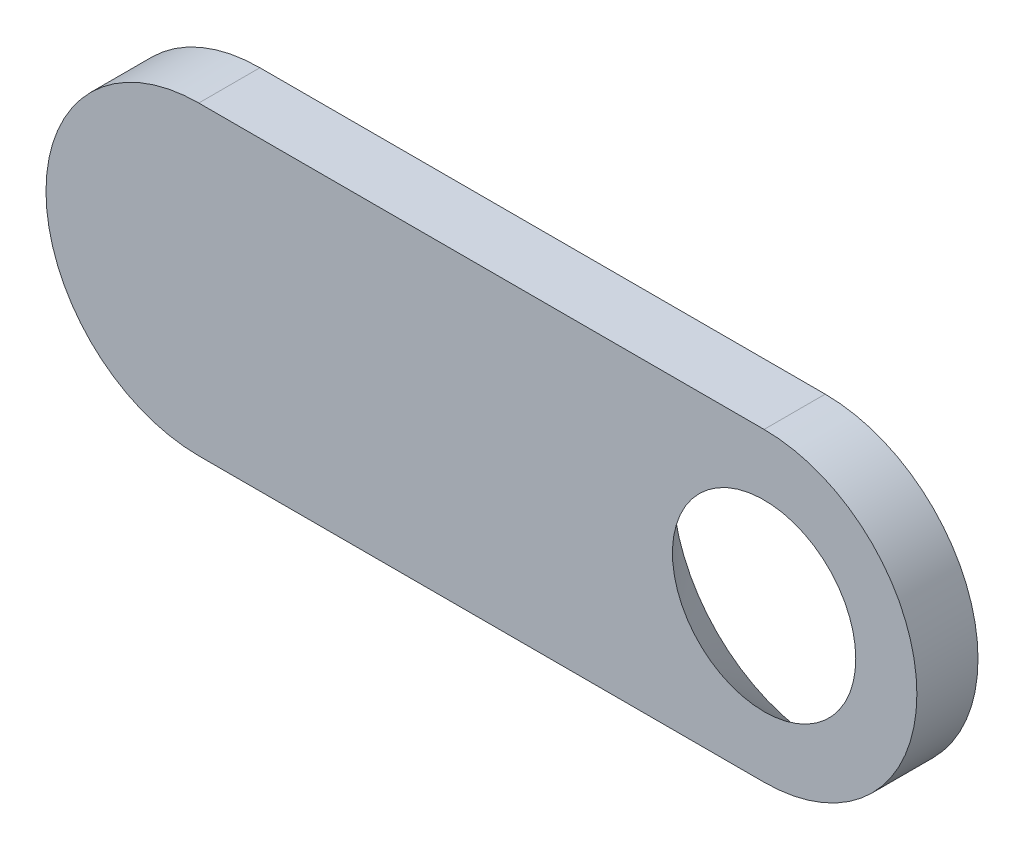
from build123d import *

# Parameters (mm, degrees)
SKETCH1_R           = 3
BOSS_EXTRUDE1_DEPTH = 2
CHAMFER1_SIZE       = 2


with BuildPart() as part:
    # Sketch1 → Boss-Extrude1 (new body)
    with BuildSketch(Plane.XY):
        with BuildLine():
            Line((34, -5), (15.5, -5))
            ThreePointArc((15.5, -5), (10.5, 0), (15.5, 5))
            Line((15.5, 5), (34, 5))
            ThreePointArc((34, 5), (39, 0), (34, -5))
        make_face()
        with Locations((34, 0)):
            Circle(SKETCH1_R, mode=Mode.SUBTRACT)
    extrude(amount=BOSS_EXTRUDE1_DEPTH)

    # Chamfer1
    chamfer1_edges = [part.edges().sort_by_distance(p)[0] for p in [
        (31, 0, 0),
    ]]
    chamfer(chamfer1_edges, length=CHAMFER1_SIZE - 0.0001)  # a hair under: the kernel refuses the full size


solid = part.part
